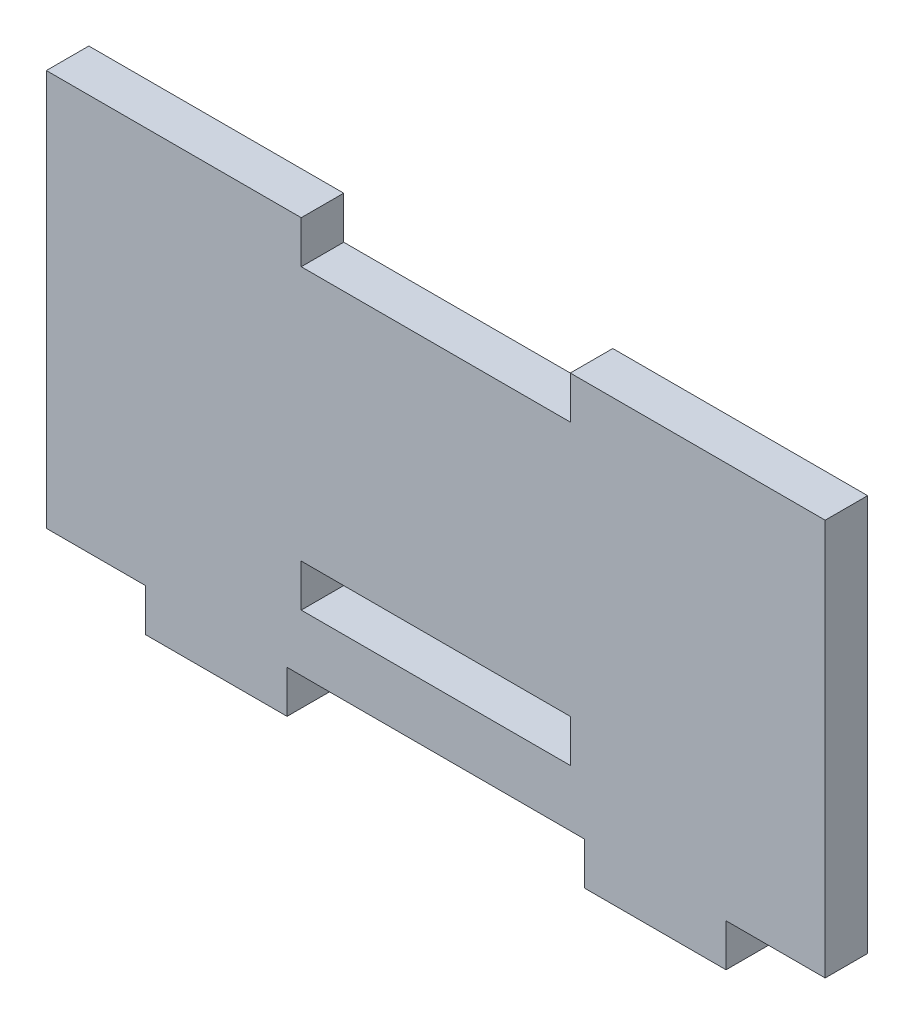
from build123d import *

# Parameters (mm, degrees)
BOSS_EXTRUDE1_DEPTH = 3


with BuildPart() as part:
    # Sketch1 → Boss-Extrude1 (new body)
    with BuildSketch(Plane.XY):
        Polygon((0, 28), (0, 0), (7, 0), (7, -3), (17, -3), (17, 0), (24, 0), (31, 0), (38, 0), (38, -3), (48, -3), (48, 0), (55, 0), (55, 28), (37, 28), (37, 25), (18, 25), (18, 28), align=None)
        Polygon((27.5, 7), (37, 7), (37, 4), (27.5, 4), (18, 4), (18, 7), align=None, mode=Mode.SUBTRACT)
    extrude(amount=BOSS_EXTRUDE1_DEPTH)


solid = part.part
